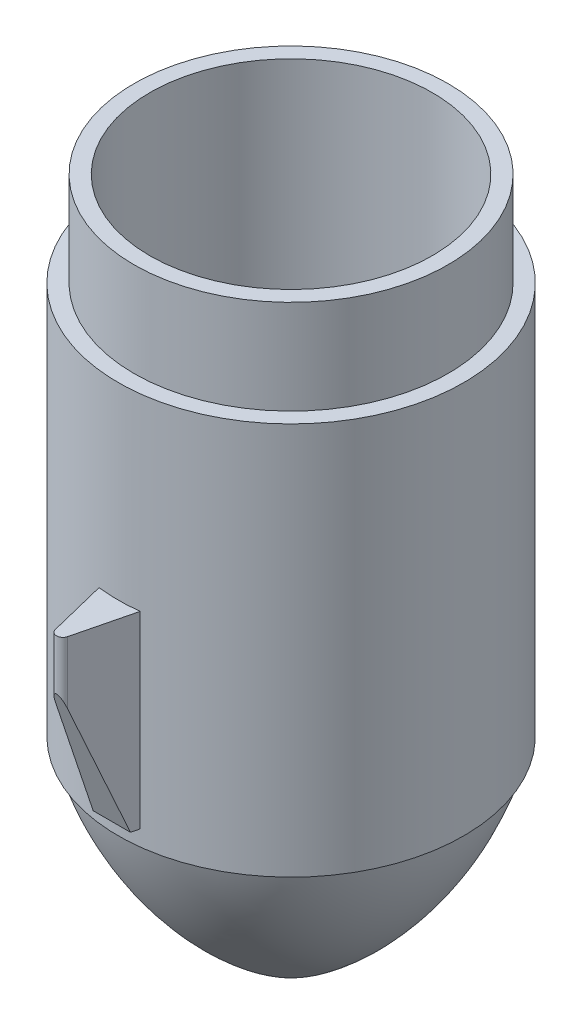
from build123d import *

# Parameters (mm, degrees)
SKETCH1_R           = 45
BOSS_EXTRUDE2_DEPTH = 150
SHELL1_T            = 5
SKETCH2_R           = 55
SKETCH2_R_2         = 50
BOSS_EXTRUDE3_DEPTH = 125
BOSS_EXTRUDE4_START = -60
BOSS_EXTRUDE4_DEPTH = 60
CUT_EXTRUDE1_DEPTH  = 7.5
CIRPATTERN1_COUNT   = 2
CIRPATTERN2_COUNT   = 2


with BuildPart() as part:
    # Sketch1 → Boss-Extrude2 (new body)
    with BuildSketch(Plane(origin=(0, 0, 0), x_dir=(1, 0, 0), z_dir=(0, 1, 0))):
        Circle(SKETCH1_R)
    extrude(amount=BOSS_EXTRUDE2_DEPTH)

    # Shell1
    shell1_openings = [part.faces().sort_by_distance(p)[0] for p in [
        (0, 150, 0),
    ]]
    offset(amount=SHELL1_T, openings=shell1_openings, kind=Kind.INTERSECTION)

    # Sketch2 → Boss-Extrude3 (add)
    with BuildSketch(Plane(origin=(0, -5, 0), x_dir=(-1, 0, 0), z_dir=(0, -1, 0))):
        Circle(SKETCH2_R)
        Circle(SKETCH2_R_2, mode=Mode.SUBTRACT)
    extrude(amount=-BOSS_EXTRUDE3_DEPTH)

    # Sketch3 → Revolve1 (revolve)
    with BuildSketch(Plane.XY):
        with BuildLine():
            Line((0, 0), (0, -70))
            ThreePointArc((0, -70), (-35.605815522, -41.368855053), (-55, 0))
            Line((-55, 0), (0, 0))
        make_face()
    revolve(axis=Axis((0, 0, 0), (0, -1, 0)))

    # Sketch4 → Boss-Extrude4 (add)
    with BuildSketch(Plane(origin=(0, 60, 0), x_dir=(1, 0, 0), z_dir=(0, 1, 0)).offset(BOSS_EXTRUDE4_START)):
        with BuildLine():
            Line((6.542791598, 54.609448616), (1.961572547, 73.12125305))
            ThreePointArc((1.961572547, 73.12125305), (0, 74.668746629), (-1.961572547, 73.12125305))
            Line((-1.961572547, 73.12125305), (-6.542791598, 54.609448616))
            ThreePointArc((-6.542791598, 54.609448616), (0, 55), (6.542791598, 54.609448616))
        make_face()
    boss_extrude4 = extrude(amount=BOSS_EXTRUDE4_DEPTH)

    # Sketch5 → Cut-Extrude1 (cut, symmetric)
    with BuildSketch(Plane(origin=(0, 0, 0), x_dir=(0, 0, -1), z_dir=(1, 0, 0))):
        Polygon((74.668746629, 43.94069989), (56.024180022, -2.622256865), (78.796904208, -2.622256865), (78.796904208, 43.94069989), align=None)
    cut_extrude1 = extrude(amount=CUT_EXTRUDE1_DEPTH, both=True, mode=Mode.SUBTRACT)

    # CirPattern1: Boss-Extrude4 ×2 about axis
    cirpattern1_axis = Axis((0, 120, 0), (0, -1, 0))
    for i in range(1, CIRPATTERN1_COUNT):
        add(boss_extrude4.rotate(cirpattern1_axis, i * 360 / CIRPATTERN1_COUNT))

    # CirPattern2: Cut-Extrude1 ×2 about axis
    cirpattern2_axis = Axis((0, 120, 0), (0, -1, 0))
    for i in range(1, CIRPATTERN2_COUNT):
        add(cut_extrude1.rotate(cirpattern2_axis, i * 360 / CIRPATTERN2_COUNT), mode=Mode.SUBTRACT)


solid = part.part
